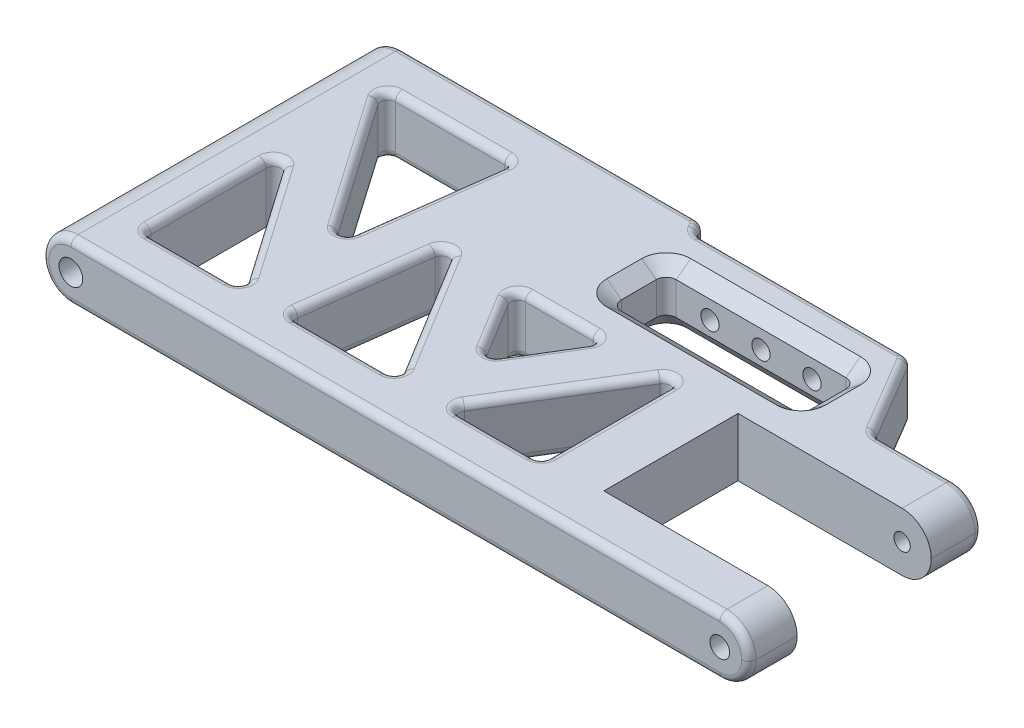
from build123d import *
from OCP.BRepFilletAPI import BRepFilletAPI_MakeChamfer

# Parameters (mm, degrees)
BOSS_EXTRU_1_DEPTH                            = 4
BOSS_EXTRU_1_DEPTH_BACK                       = 4
CONG_1_R                                      = 4
CONG_2_R                                      = 1
CHANFREIN2_SIZE                               = 2
CHANFREIN2_SIZE2                              = 1.5
ENL_V_MAT_EXTRU_1_DEPTH                       = 100.712398932
ENL_V_MAT_EXTRU_1_DEPTH_BACK                  = 8.25
ESQUISSE6_R                                   = 1.125
ENL_V_MAT_EXTRU_2_DEPTH                       = 100.712398932
ENL_V_MAT_EXTRU_2_DEPTH_BACK                  = 100.712398932
ESQUISSE14_R                                  = 1.625
TROU_TARAUD_M31_D                             = 2.5
TROU_TARAUD_M31_DEPTH                         = 16
TROU_TARAUD_M31_TIP                           = 0.751075774
TROU_POUR_TARAUDAGE_POUR_TROU_TARAUD_M3_D     = 2.7
TROU_POUR_TARAUDAGE_POUR_TROU_TARAUD_M3_DEPTH = 3
TROU_POUR_TARAUDAGE_POUR_TROU_TARAUD_M3_TIP   = 0.811161836


with BuildPart() as part:
    # Esquisse1 → Boss.-Extru.1 (new, two sides: drawn at the far end of the back side and taken through both)
    with BuildSketch(Plane(origin=(0, 0, 0), x_dir=(1, 0, 0), z_dir=(0, 1, 0)).offset(-BOSS_EXTRU_1_DEPTH_BACK)):
        with BuildLine():
            Line((97, 2.25), (97, 9.25))
            Line((97, 9.25), (83, 9.25))
            ThreePointArc((83, 9.25), (82.325488354, 9.428591801), (81.827729995, 9.917567882))
            Line((81.827729995, 9.917567882), (75.708100575, 20.232432118))
            ThreePointArc((75.708100575, 20.232432118), (75.210342216, 20.721408199), (74.53583057, 20.9))
            Line((74.53583057, 20.9), (46.908568545, 20.9))
            ThreePointArc((46.908568545, 20.9), (46.234056899, 21.078591801), (45.73629854, 21.567567882))
            Line((45.73629854, 21.567567882), (45.43083855, 22.082432118))
            ThreePointArc((45.43083855, 22.082432118), (44.933080191, 22.571408199), (44.258568545, 22.75))
            Line((44.258568545, 22.75), (0, 22.75))
            Line((0, 22.75), (0, -22.75))
            Line((0, -22.75), (97, -22.75))
            Line((97, -22.75), (97, -16.15))
            Line((97, -16.15), (70.5, -16.15))
            Line((70.5, -16.15), (70.5, 2.25))
            Line((70.5, 2.25), (97, 2.25))
        make_face()
        with BuildLine():
            Line((62.5, -15.75), (62.5, 0.9))
            ThreePointArc((62.5, 0.9), (61.770964693, 1.862589287), (60.646843729, 1.421655421))
            Line((60.646843729, 1.421655421), (50.466337473, -15.228344579))
            ThreePointArc((50.466337473, -15.228344579), (50.447239359, -16.239052441), (51.319493743, -16.75))
            Line((51.319493743, -16.75), (61.5, -16.75))
            ThreePointArc((61.5, -16.75), (62.207106781, -16.457106781), (62.5, -15.75))
        make_face(mode=Mode.SUBTRACT)
        with BuildLine():
            Line((40.834895097, 0.378344579), (45.466337473, -7.196280259))
            ThreePointArc((45.466337473, -7.196280259), (46.319493743, -7.674624838), (47.172650014, -7.196280259))
            Line((47.172650014, -7.196280259), (51.80409239, 0.378344579))
            ThreePointArc((51.80409239, 0.378344579), (51.823190503, 1.389052441), (50.950936119, 1.9))
            Line((50.950936119, 1.9), (41.688051367, 1.9))
            ThreePointArc((41.688051367, 1.9), (40.815796983, 1.389052441), (40.834895097, 0.378344579))
        make_face(mode=Mode.SUBTRACT)
        with BuildLine():
            Line((28.966892325, -16.75), (41.319493743, -16.75))
            ThreePointArc((41.319493743, -16.75), (42.191748127, -16.239052441), (42.172650014, -15.228344579))
            Line((42.172650014, -15.228344579), (31.992143757, 1.421655421))
            ThreePointArc((31.992143757, 1.421655421), (30.930984062, 1.878128098), (30.147389795, 1.029360033))
            Line((30.147389795, 1.029360033), (27.975294634, -15.620639967))
            ThreePointArc((27.975294634, -15.620639967), (28.215440386, -16.409787832), (28.966892325, -16.75))
        make_face(mode=Mode.SUBTRACT)
        with BuildLine():
            Line((9, -16.75), (19.966892325, -16.75))
            ThreePointArc((19.966892325, -16.75), (20.853297586, -16.21291005), (20.787544132, -15.178571429))
            Line((20.787544132, -15.178571429), (9.820651807, 0.571428571))
            ThreePointArc((9.820651807, 0.571428571), (8.700543665, 0.954110006), (8, 0))
            Line((8, 0), (8, -15.75))
            ThreePointArc((8, -15.75), (8.292893219, -16.457106781), (9, -16.75))
        make_face(mode=Mode.SUBTRACT)
        with BuildLine():
            Line((8.179348193, 15.178571429), (20.812486689, -2.964392449))
            ThreePointArc((20.812486689, -2.964392449), (21.870123246, -3.364477248), (22.624736187, -2.52232391))
            Line((22.624736187, -2.52232391), (24.991597692, 15.620639967))
            ThreePointArc((24.991597692, 15.620639967), (24.751451939, 16.409787832), (24, 16.75))
            Line((24, 16.75), (9, 16.75))
            ThreePointArc((9, 16.75), (8.11359474, 16.21291005), (8.179348193, 15.178571429))
        make_face(mode=Mode.SUBTRACT)
        with BuildLine():
            Line((48.863055272, 15.4), (72.136944728, 15.4))
            ThreePointArc((72.136944728, 15.4), (73.100770354, 15.000770354), (73.5, 14.036944728))
            Line((73.5, 14.036944728), (73.5, 9.263055272))
            ThreePointArc((73.5, 9.263055272), (73.100770354, 8.299229646), (72.136944728, 7.9))
            Line((72.136944728, 7.9), (48.863055272, 7.9))
            ThreePointArc((48.863055272, 7.9), (47.899229646, 8.299229646), (47.5, 9.263055272))
            Line((47.5, 9.263055272), (47.5, 14.036944728))
            ThreePointArc((47.5, 14.036944728), (47.899229646, 15.000770354), (48.863055272, 15.4))
        make_face(mode=Mode.SUBTRACT)
    extrude(amount=BOSS_EXTRU_1_DEPTH + BOSS_EXTRU_1_DEPTH_BACK)

    # Congé1
    cong_1_edges = [part.edges().sort_by_distance(p)[0] for p in [
        (0, 4, 0),
        (97, -4, -5.75),
        (97, -4, 19.45),
        (97, 4, 19.45),
        (97, 4, -5.75),
        (0, -4, 0),
    ]]
    fillet(cong_1_edges, radius=CONG_1_R - 0.0001)  # a hair under: the kernel refuses the full size

    # Congé2
    cong_2_edges = [part.edges().sort_by_distance(p)[0] for p in [
        (21.870123246, -4, 3.364477248),
        (14.495917441, -4, -6.10708949),
        (8.11359474, -4, -16.21291005),
        (16.5, -4, -16.75),
        (24.751451939, -4, -16.409787832),
        (23.808166939, -4, -6.549158028),
        (82.325488354, 4, -9.428591801),
        (78.767915285, 4, -15.075),
        (75.210342216, 4, -20.721408199),
        (60.722199558, 4, -20.9),
        (46.234056899, 4, -21.078591801),
        (45.583568545, 4, -21.825),
        (44.933080191, 4, -22.571408199),
        (24.129234273, 4, -22.75),
        (62.207106781, 4, 16.457106781),
        (62.5, 4, 7.425),
        (61.770964693, 4, -1.862589287),
        (55.556590601, 4, 6.903344579),
        (50.447239359, 4, 16.239052441),
        (56.409746872, 4, 16.75),
        (40.815796983, 4, -1.389052441),
        (43.150616285, 4, 3.40896784),
        (46.319493743, 4, 7.674624838),
        (49.488371202, 4, 3.40896784),
        (51.823190503, 4, -1.389052441),
        (46.319493743, 4, -1.9),
        (42.191748127, 4, 16.239052441),
        (37.082396886, 4, 6.903344579),
        (30.930984062, 4, -1.878128098),
        (29.061342214, 4, 7.295639967),
        (28.215440386, 4, 16.409787832),
        (35.143193034, 4, 16.75),
        (20.853297586, 4, 16.21291005),
        (15.304097969, 4, 7.303571429),
        (8.700543665, 4, -0.954110006),
        (8, 4, 7.875),
        (8.292893219, 4, 16.457106781),
        (14.483446163, 4, 16.75),
        (21.870123246, 4, 3.364477248),
        (23.808166939, 4, -6.549158028),
        (24.751451939, 4, -16.409787832),
        (16.5, 4, -16.75),
        (8.11359474, 4, -16.21291005),
        (14.495917441, 4, -6.10708949),
        (88.00005, 4, -9.25),
        (88.00005, -4, -9.25),
        (95.828456414, 2.828456414, -9.25),
        (95.828456414, -2.828456414, -9.25),
        (82.325488354, -4, -9.428591801),
        (48.5, -4, 22.75),
        (48.5, 4, 22.75),
        (1.171543586, 2.828456414, 22.75),
        (1.171543586, -2.828456414, 22.75),
        (95.828456414, 2.828456414, 22.75),
        (95.828456414, -2.828456414, 22.75),
        (1.171543586, 2.828456414, -22.75),
        (1.171543586, -2.828456414, -22.75),
        (78.767915285, -4, -15.075),
        (75.210342216, -4, -20.721408199),
        (60.722199558, -4, -20.9),
        (46.234056899, -4, -21.078591801),
        (62.207106781, -4, 16.457106781),
        (45.583568545, -4, -21.825),
        (56.409746872, -4, 16.75),
        (50.447239359, -4, 16.239052441),
        (55.556590601, -4, 6.903344579),
        (61.770964693, -4, -1.862589287),
        (62.5, -4, 7.425),
        (44.933080191, -4, -22.571408199),
        (24.129234273, -4, -22.75),
        (40.815796983, -4, -1.389052441),
        (46.319493743, -4, -1.9),
        (51.823190503, -4, -1.389052441),
        (49.488371202, -4, 3.40896784),
        (46.319493743, -4, 7.674624838),
        (43.150616285, -4, 3.40896784),
        (42.191748127, -4, 16.239052441),
        (35.143193034, -4, 16.75),
        (28.215440386, -4, 16.409787832),
        (29.061342214, -4, 7.295639967),
        (30.930984062, -4, -1.878128098),
        (37.082396886, -4, 6.903344579),
    ]]
    fillet(cong_2_edges, radius=CONG_2_R)

    # Chanfrein2: one chamfer whose edges measure the first distance from different faces: ONE call of the kernel's chamfer builder (chamfer() names one face for all edges)
    chanfrein2_edges_1 = [part.edges().sort_by_distance(p)[0] for p in [
        (47.899229646, -4, -15.000770354),
    ]]
    chanfrein2_side_1 = [part.faces().sort_by_distance(p)[0] for p in [
        (47.899229646, 0, -15.000770354),
    ]]
    chanfrein2_edges_2 = [part.edges().sort_by_distance(p)[0] for p in [
        (60.5, -4, -15.4),
    ]]
    chanfrein2_side_2 = [part.faces().sort_by_distance(p)[0] for p in [
        (60.5, 0, -15.4),
    ]]
    chanfrein2_edges_3 = [part.edges().sort_by_distance(p)[0] for p in [
        (73.100770354, -4, -15.000770354),
    ]]
    chanfrein2_side_3 = [part.faces().sort_by_distance(p)[0] for p in [
        (73.100770354, 0, -15.000770354),
    ]]
    chanfrein2_edges_4 = [part.edges().sort_by_distance(p)[0] for p in [
        (73.5, -4, -11.65),
    ]]
    chanfrein2_side_4 = [part.faces().sort_by_distance(p)[0] for p in [
        (73.5, 0, -11.65),
    ]]
    chanfrein2_edges_5 = [part.edges().sort_by_distance(p)[0] for p in [
        (73.100770354, -4, -8.299229646),
    ]]
    chanfrein2_side_5 = [part.faces().sort_by_distance(p)[0] for p in [
        (73.100770354, 0, -8.299229646),
    ]]
    chanfrein2_edges_6 = [part.edges().sort_by_distance(p)[0] for p in [
        (60.5, -4, -7.9),
    ]]
    chanfrein2_side_6 = [part.faces().sort_by_distance(p)[0] for p in [
        (60.5, 0, -7.9),
    ]]
    chanfrein2_edges_7 = [part.edges().sort_by_distance(p)[0] for p in [
        (47.899229646, -4, -8.299229646),
    ]]
    chanfrein2_side_7 = [part.faces().sort_by_distance(p)[0] for p in [
        (47.899229646, 0, -8.299229646),
    ]]
    chanfrein2_edges_8 = [part.edges().sort_by_distance(p)[0] for p in [
        (47.5, -4, -11.65),
    ]]
    chanfrein2_side_8 = [part.faces().sort_by_distance(p)[0] for p in [
        (47.5, 0, -11.65),
    ]]
    chanfrein2_edges_9 = [part.edges().sort_by_distance(p)[0] for p in [
        (47.899229646, 4, -15.000770354),
        (47.5, 4, -11.65),
        (47.899229646, 4, -8.299229646),
        (60.5, 4, -7.9),
        (73.100770354, 4, -8.299229646),
        (73.5, 4, -11.65),
        (73.100770354, 4, -15.000770354),
        (60.5, 4, -15.4),
    ]]
    chanfrein2_side_9 = [part.faces().sort_by_distance(p)[0] for p in [
        (92.009479709, 4, -5.25),
    ]]
    chanfrein2 = BRepFilletAPI_MakeChamfer(part.part.solid().wrapped)
    for e in chanfrein2_edges_1:
        chanfrein2.Add(CHANFREIN2_SIZE, CHANFREIN2_SIZE2, e.wrapped, chanfrein2_side_1[0].wrapped)  # the first distance lies on this face
    for e in chanfrein2_edges_2:
        chanfrein2.Add(CHANFREIN2_SIZE, CHANFREIN2_SIZE2, e.wrapped, chanfrein2_side_2[0].wrapped)  # the first distance lies on this face
    for e in chanfrein2_edges_3:
        chanfrein2.Add(CHANFREIN2_SIZE, CHANFREIN2_SIZE2, e.wrapped, chanfrein2_side_3[0].wrapped)  # the first distance lies on this face
    for e in chanfrein2_edges_4:
        chanfrein2.Add(CHANFREIN2_SIZE, CHANFREIN2_SIZE2, e.wrapped, chanfrein2_side_4[0].wrapped)  # the first distance lies on this face
    for e in chanfrein2_edges_5:
        chanfrein2.Add(CHANFREIN2_SIZE, CHANFREIN2_SIZE2, e.wrapped, chanfrein2_side_5[0].wrapped)  # the first distance lies on this face
    for e in chanfrein2_edges_6:
        chanfrein2.Add(CHANFREIN2_SIZE, CHANFREIN2_SIZE2, e.wrapped, chanfrein2_side_6[0].wrapped)  # the first distance lies on this face
    for e in chanfrein2_edges_7:
        chanfrein2.Add(CHANFREIN2_SIZE, CHANFREIN2_SIZE2, e.wrapped, chanfrein2_side_7[0].wrapped)  # the first distance lies on this face
    for e in chanfrein2_edges_8:
        chanfrein2.Add(CHANFREIN2_SIZE, CHANFREIN2_SIZE2, e.wrapped, chanfrein2_side_8[0].wrapped)  # the first distance lies on this face
    for e in chanfrein2_edges_9:
        chanfrein2.Add(CHANFREIN2_SIZE, CHANFREIN2_SIZE2, e.wrapped, chanfrein2_side_9[0].wrapped)  # the first distance lies on this face
    add(Compound.cast(chanfrein2.Shape()), mode=Mode.REPLACE)

    # Esquisse6 → Enlèv. mat.-Extru.1 (cut, two sides: drawn at the far end of the back side and taken through both)
    with BuildSketch(Plane.XY.offset(-ENL_V_MAT_EXTRU_1_DEPTH_BACK)):
        with Locations((93, 0)):
            Circle(ESQUISSE6_R)
    extrude(amount=ENL_V_MAT_EXTRU_1_DEPTH + ENL_V_MAT_EXTRU_1_DEPTH_BACK, mode=Mode.SUBTRACT)

    # Esquisse14 → Enlèv. mat.-Extru.2 (cut, two sides: drawn at the far end of the back side and taken through both)
    with BuildSketch(Plane.XY.offset(-ENL_V_MAT_EXTRU_2_DEPTH_BACK)):
        with Locations((4, 0)):
            Circle(ESQUISSE14_R)
    extrude(amount=ENL_V_MAT_EXTRU_2_DEPTH + ENL_V_MAT_EXTRU_2_DEPTH_BACK, mode=Mode.SUBTRACT)

    # Trou taraudé M31
    with Locations(Plane(origin=(0, 0, -20.9), x_dir=(-1, 0, 0), z_dir=(0, 0, -1))):
        with Locations((-60.5, 0), (-53.5, 0), (-67.5, 0)):
            Hole(TROU_TARAUD_M31_D / 2, depth=TROU_TARAUD_M31_DEPTH)
            with Locations((0, 0, -(TROU_TARAUD_M31_DEPTH + TROU_TARAUD_M31_TIP / 2))):  # 118° drill point
                Cone(0, TROU_TARAUD_M31_D / 2, TROU_TARAUD_M31_TIP, mode=Mode.SUBTRACT)

    # Trou pour taraudage pour trou taraudé M31
    with Locations(Plane.XY.offset(22.75)):
        with Locations((93, 0)):
            Hole(TROU_POUR_TARAUDAGE_POUR_TROU_TARAUD_M3_D / 2, depth=TROU_POUR_TARAUDAGE_POUR_TROU_TARAUD_M3_DEPTH)
            with Locations((0, 0, -(TROU_POUR_TARAUDAGE_POUR_TROU_TARAUD_M3_DEPTH + TROU_POUR_TARAUDAGE_POUR_TROU_TARAUD_M3_TIP / 2))):  # 118° drill point
                Cone(0, TROU_POUR_TARAUDAGE_POUR_TROU_TARAUD_M3_D / 2, TROU_POUR_TARAUDAGE_POUR_TROU_TARAUD_M3_TIP, mode=Mode.SUBTRACT)


solid = part.part
